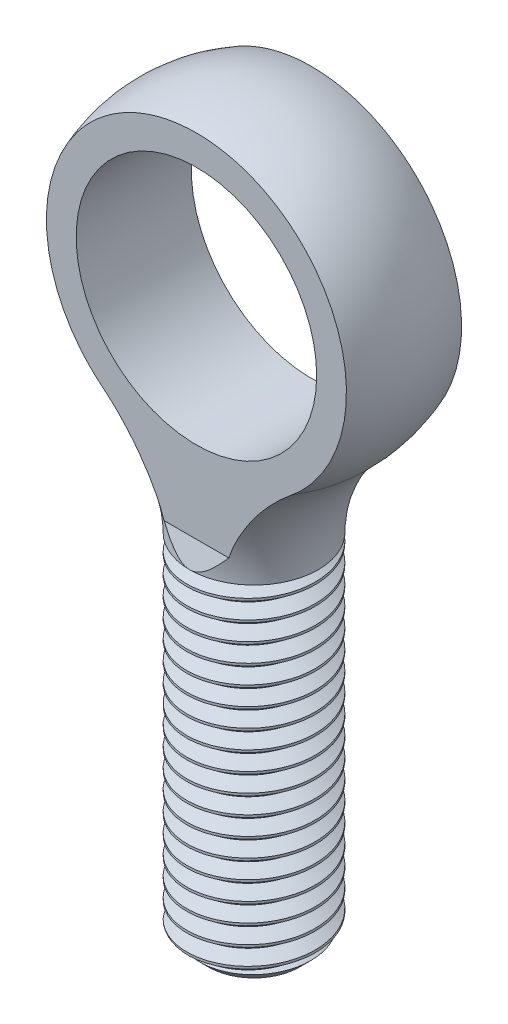
from build123d import *

# Parameters (mm, degrees)
SKETCH1_W               = 6
SKETCH1_H               = 33
CHAMFER2_SIZE           = 1.75
CUT_SWEEP1_PITCH        = 1.75
CUT_EXTRUDE1_DEPTH      = 42.785164832
CUT_EXTRUDE1_DEPTH_BACK = 42.785164832
CUT_EXTRUDE2_DEPTH      = 40.45883933
CUT_EXTRUDE2_DEPTH_BACK = 40.45883933
SKETCH6_R               = 11.22615


with BuildPart() as part:
    # Sketch1 → Revolve1 (revolve)
    with BuildSketch(Plane.XY, mode=Mode.PRIVATE) as revolve1_sk:
        with Locations((3, -16.5)):
            Rectangle(SKETCH1_W, SKETCH1_H)
    revolve(revolve1_sk.sketch.rotate(Axis((0, 36, 0), (0, -1, 0)), 180), axis=Axis((0, 36, 0), (0, -1, 0)))

    # Chamfer2
    chamfer2_edges = [part.edges().sort_by_distance(p)[0] for p in [
        (6, -33, 0),
    ]]
    chamfer(chamfer2_edges, length=CHAMFER2_SIZE)

    # Cut-Sweep1: the profile of Sketch13 profile screwed along a right-hand helix of 19.857143 turns, 10 arcs to a turn; built about Z, then put on its axis
    cut_sweep1_z = Axis((0, 0, 0), (0, 0, 1))
    cut_sweep1_corners = [(6.0003, 0, -1.531423205), (6.0003, 0, 0.000173205), (4.863341658, 0, -0.65625), (4.863341658, 0, -0.875)]
    with BuildLine(mode=Mode.PRIVATE) as cut_sweep1_profile:
        Line(cut_sweep1_corners[0], cut_sweep1_corners[1])
        Line(cut_sweep1_corners[1], cut_sweep1_corners[2])
        Line(cut_sweep1_corners[2], cut_sweep1_corners[3])
        Line(cut_sweep1_corners[3], cut_sweep1_corners[0])
    cut_sweep1_cap = Face(cut_sweep1_profile.wire())
    cut_sweep1_turn_angles = [0, 18, 36, 54, 72, 90, 108, 126, 144, 162, 180, 198, 216, 234, 252, 270, 288, 306, 324, 342, 360]
    cut_sweep1_turn_weights = [1, 0.9510565162951535, 1, 0.9510565162951535, 1, 0.9510565162951535, 1, 0.9510565162951535, 1, 0.9510565162951535, 1, 0.9510565162951535, 1, 0.9510565162951535, 1, 0.9510565162951535, 1, 0.9510565162951535, 1, 0.9510565162951535, 1]
    cut_sweep1_turn_rails = [Edge.make_bspline([Vector(p[0], p[1], 0).rotate(cut_sweep1_z, cut_sweep1_turn_angles[k]) / cut_sweep1_turn_weights[k] + Vector(0, 0, p[2] + CUT_SWEEP1_PITCH * cut_sweep1_turn_angles[k] / 360) for k in range(21)], [0, 0, 0, 1, 1, 2, 2, 3, 3, 4, 4, 5, 5, 6, 6, 7, 7, 8, 8, 9, 9, 10, 10, 10], 2, cut_sweep1_turn_weights) for p in cut_sweep1_corners]
    cut_sweep1_turn_sides = [Face.make_surface_from_curves(cut_sweep1_turn_rails[p[0]], cut_sweep1_turn_rails[p[1]]) for p in [(0, 1), (1, 2), (2, 3), (3, 0)]]
    cut_sweep1_last_angles = [6840, 6858, 6876, 6894, 6912, 6930, 6948, 6966, 6984, 7002, 7020, 7038, 7056, 7074, 7092, 7110, 7128, 7138.285714286, 7148.571428572]
    cut_sweep1_last_weights = [1, 0.9510565162951535, 1, 0.9510565162951535, 1, 0.9510565162951535, 1, 0.9510565162951535, 1, 0.9510565162951535, 1, 0.9510565162951535, 1, 0.9510565162951535, 1, 0.9510565162951535, 1, 0.9839295885985179, 1]
    cut_sweep1_last_rails = [Edge.make_bspline([Vector(p[0], p[1], 0).rotate(cut_sweep1_z, cut_sweep1_last_angles[k]) / cut_sweep1_last_weights[k] + Vector(0, 0, p[2] + CUT_SWEEP1_PITCH * cut_sweep1_last_angles[k] / 360) for k in range(19)], [0, 0, 0, 1, 1, 2, 2, 3, 3, 4, 4, 5, 5, 6, 6, 7, 7, 8, 8, 9, 9, 9], 2, cut_sweep1_last_weights) for p in cut_sweep1_corners]
    cut_sweep1_last_sides = [Face.make_surface_from_curves(cut_sweep1_last_rails[p[0]], cut_sweep1_last_rails[p[1]]) for p in [(0, 1), (1, 2), (2, 3), (3, 0)]]
    cut_sweep1 = Plane(origin=(0, -33, 0), x_dir=(0, 0, 1), z_dir=(0, 1, 0)) * Solid(Shell([*[p.moved(Location((0, 0, CUT_SWEEP1_PITCH * i))) for i in range(19) for p in cut_sweep1_turn_sides], *cut_sweep1_last_sides, cut_sweep1_cap, cut_sweep1_cap.rotate(cut_sweep1_z, 7148.571428572).moved(Location((0, 0, CUT_SWEEP1_PITCH * 7148.571428572 / 360)))]))
    add(cut_sweep1, mode=Mode.SUBTRACT)

    # Sketch4 → Revolve2 (revolve)
    with BuildSketch(Plane.XY):
        with BuildLine():
            Line((6, 0), (0, 0))
            Line((0, 0), (0, 36))
            ThreePointArc((0, 36), (13.927150363, 26.570860145), (10.344827586, 10.137931034))
            ThreePointArc((10.344827586, 10.137931034), (7.13196958, 5.51487018), (6, 0))
        make_face()
    revolve(axis=Axis((0, 36, 0), (0, 1, 0)))

    # Sketch5 → Cut-Extrude1 (cut, two sides: drawn at the far end of the back side and taken through both)
    with BuildSketch(Plane(origin=(0, 0, 0), x_dir=(0, 0, -1), z_dir=(1, 0, 0)).offset(-CUT_EXTRUDE1_DEPTH_BACK)):
        Polygon((5.375, 36), (15, 36), (15, 0), (6, 0), (5.375, 2.15), align=None)
        Polygon((-5.375, 36), (-5.375, 2.15), (-6, 0), (-15, 0), (-15, 36), align=None)
    extrude(amount=CUT_EXTRUDE1_DEPTH + CUT_EXTRUDE1_DEPTH_BACK, mode=Mode.SUBTRACT)

    # Sketch6 → Cut-Extrude2 (cut, two sides: drawn at the far end of the back side and taken through both)
    with BuildSketch(Plane.XY.offset(-CUT_EXTRUDE2_DEPTH_BACK)):
        with Locations((0, 21)):
            Circle(SKETCH6_R)
    extrude(amount=CUT_EXTRUDE2_DEPTH + CUT_EXTRUDE2_DEPTH_BACK, mode=Mode.SUBTRACT)


solid = part.part
